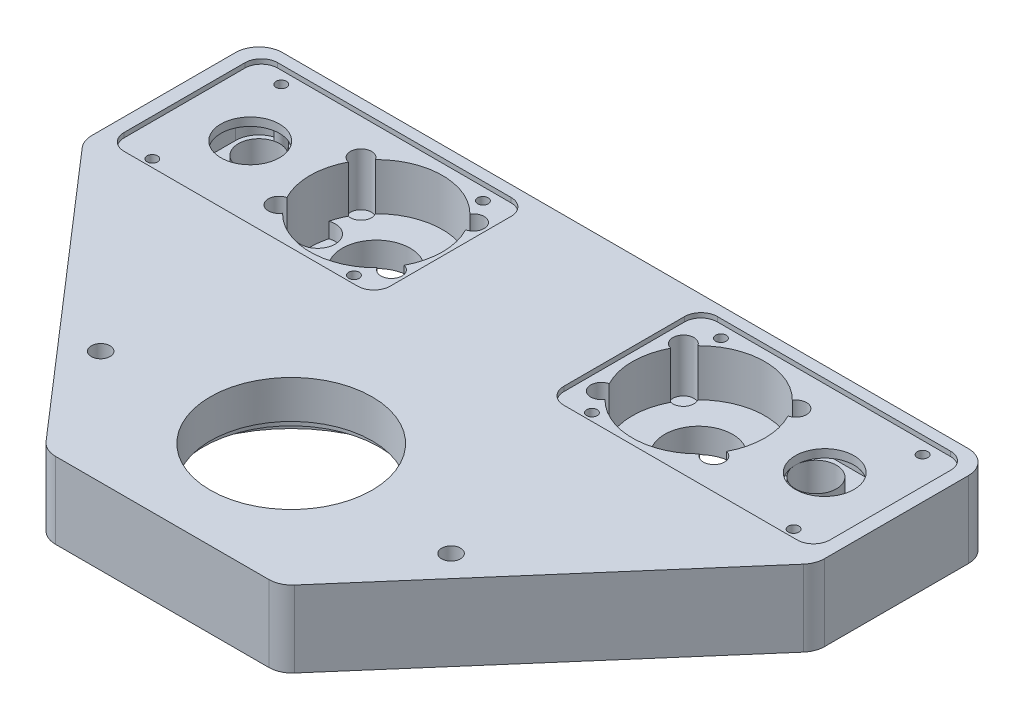
from build123d import *

# Parameters (mm, degrees)
SKETCH1_R             = 2.032
SKETCH1_R_2           = 7.366
SKETCH1_R_3           = 11.176
SKETCH1_R_4           = 17.526
BOSS_EXTRUDE1_DEPTH   = 16.51
CUT_EXTRUDE4_DEPTH    = 6.35
SKETCH2_R             = 19.05
SKETCH2_R_2           = 12.7
CUT_EXTRUDE3_DEPTH    = 1.905
CAVITY1_START         = 5.334
CAVITY1_OUTLINE_R     = 7.366
CAVITY1_OUTLINE_R_2   = 1.143
CAVITY1_OUTLINE_R_3   = 4.445
CAVITY1_DEPTH         = 11.176
CAVITY1_START_2       = 15.494
CAVITY1_2_OUTLINE_R   = 1.143
CAVITY1_2_OUTLINE_R_2 = 4.445
CAVITY1_2_DEPTH       = 1.016
CAVITY1_START_3       = 2.286
CAVITY1_3_OUTLINE_R   = 1.143
CAVITY1_3_OUTLINE_R_2 = 4.445
CAVITY1_3_DEPTH       = 3.048
CAVITY1_4_OUTLINE_R   = 1.905
CAVITY1_4_DEPTH       = 3.302
CAVITY1_START_4       = 13.716
CAVITY1_5_DEPTH       = 1.778
CAVITY1_START_5       = 4.064
CAVITY1_6_OUTLINE_R   = 2.286
CAVITY1_6_DEPTH       = 1.27
CAVITY1_START_6       = 2.032
CAVITY1_7_DEPTH       = 0.254
BOSS_EXTRUDE2_START   = -1.27
SKETCH4_R             = 11.176
BOSS_EXTRUDE2_DEPTH   = 1.27
FILLET1_R             = 5.08
SKETCH5_W             = 6.604
SKETCH5_H             = 6.604
CUT_EXTRUDE5_DEPTH    = 6.35


# Read off the part's stored shape, not the designer's step: Cavity1
with BuildPart() as part:
    # Sketch1 → Boss-Extrude1 (new body)
    with BuildSketch(Plane(origin=(0, 0, 0), x_dir=(1, 0, 0), z_dir=(0, 1, 0))):
        Polygon((25.4, -66.04), (-25.4, -66.04), (-79.375, -3.81), (-79.375, 34.29), (79.375, 34.29), (79.375, -3.81), align=None)
        with Locations(Location((-37.955017997, -41.420633799, 0), (0, 0, 270))):
            Circle(SKETCH1_R, mode=Mode.SUBTRACT)
        with Locations(Location((-34.919226796, 15.24, 0), (0, 0, 270))):
            Circle(SKETCH1_R_2, mode=Mode.SUBTRACT)
        with Locations(Location((0, 0, 0), (0, 0, 270))):
            Circle(SKETCH1_R_3, mode=Mode.SUBTRACT)
        with Locations(Location((0, -38.1, 0), (0, 0, 270))):
            Circle(SKETCH1_R_4, mode=Mode.SUBTRACT)
        with Locations(Location((37.955017997, -41.420633799, 0), (0, 0, 90))):
            Circle(SKETCH1_R, mode=Mode.SUBTRACT)
        with Locations(Location((34.919226796, 15.24, 0), (0, 0, 90))):
            Circle(SKETCH1_R_2, mode=Mode.SUBTRACT)
    extrude(amount=BOSS_EXTRUDE1_DEPTH)

    # Sketch3 → Cut-Extrude4 (cut)
    with BuildSketch(Plane.XZ):
        with BuildLine():
            ThreePointArc((9.692022286, 12.573), (0, 65.405), (-9.692022286, 12.573))
            ThreePointArc((-9.692022286, 12.573), (0, -15.875), (9.692022286, 12.573))
        make_face()
    extrude(amount=-CUT_EXTRUDE4_DEPTH, mode=Mode.SUBTRACT)

    # Sketch2 → Cut-Extrude3 (cut)
    with BuildSketch(Plane(origin=(0, 6.35, 0), x_dir=(-1, 0, 0), z_dir=(0, -1, 0))):
        with Locations(Location((0, -38.1, 0), (0, 0, 90))):
            Circle(SKETCH2_R)
        with Locations(Location((0, 0, 0), (0, 0, 90))):
            Circle(SKETCH2_R_2)
    extrude(amount=-CUT_EXTRUDE3_DEPTH, mode=Mode.SUBTRACT)

    # Cavity1 outline → Cavity1 (cut)
    # profile 1 of 12: a face of its own
    with BuildSketch(Plane(origin=(0, 0, 0), x_dir=(1, 0, 0), z_dir=(0, 1, 0)).offset(CAVITY1_START)):
        with BuildLine():
            ThreePointArc((24.688659292, 5.175871148), (34.919226795, 0.889), (45.149794299, 5.175871148))
            ThreePointArc((45.149794299, 5.175871148), (48.95833201, 5.003152448), (47.629415314, 8.576494253))
            ThreePointArc((47.629415314, 8.576494253), (49.270226796, 15.24), (47.629415314, 21.903505747))
            ThreePointArc((47.629415314, 21.903505747), (48.95833201, 25.476847552), (45.149794299, 25.304128852))
            ThreePointArc((45.149794299, 25.304128852), (34.919226796, 29.591), (24.688659292, 25.304128852))
            ThreePointArc((24.688659292, 25.304128852), (20.880121582, 25.476847552), (22.209038278, 21.903505747))
            ThreePointArc((22.209038278, 21.903505747), (20.568226796, 15.24), (22.209038278, 8.576494253))
            ThreePointArc((22.209038278, 8.576494253), (20.880121582, 5.003152448), (24.688659292, 5.175871148))
        make_face()
        with Locations((34.919226796, 15.24)):
            Circle(CAVITY1_OUTLINE_R, mode=Mode.SUBTRACT)
    # profile 2 of 12: a face of its own
    with BuildSketch(Plane(origin=(0, 0, 0), x_dir=(1, 0, 0), z_dir=(0, 1, 0)).offset(CAVITY1_START)):
        with Locations((25.775226796, 1.27)):
            Circle(CAVITY1_OUTLINE_R_2)
    # profile 3 of 12: a face of its own
    with BuildSketch(Plane(origin=(0, 0, 0), x_dir=(1, 0, 0), z_dir=(0, 1, 0)).offset(CAVITY1_START)):
        with Locations((69.463226796, 1.27)):
            Circle(CAVITY1_OUTLINE_R_2)
    # profile 4 of 12: a face of its own
    with BuildSketch(Plane(origin=(0, 0, 0), x_dir=(1, 0, 0), z_dir=(0, 1, 0)).offset(CAVITY1_START)):
        with Locations((25.775226796, 29.21)):
            Circle(CAVITY1_OUTLINE_R_2)
    # profile 5 of 12: a face of its own
    with BuildSketch(Plane(origin=(0, 0, 0), x_dir=(1, 0, 0), z_dir=(0, 1, 0)).offset(CAVITY1_START)):
        with BuildLine():
            ThreePointArc((-24.688659292, 25.304128852), (-34.919226796, 29.591), (-45.149794299, 25.304128852))
            ThreePointArc((-45.149794299, 25.304128852), (-48.95833201, 25.476847552), (-47.629415314, 21.903505747))
            ThreePointArc((-47.629415314, 21.903505747), (-49.270226796, 15.24), (-47.629415314, 8.576494253))
            ThreePointArc((-47.629415314, 8.576494253), (-48.95833201, 5.003152448), (-45.149794299, 5.175871148))
            ThreePointArc((-45.149794299, 5.175871148), (-34.919226796, 0.889), (-24.688659292, 5.175871148))
            ThreePointArc((-24.688659292, 5.175871148), (-20.880121582, 5.003152448), (-22.209038278, 8.576494253))
            ThreePointArc((-22.209038278, 8.576494253), (-20.568226796, 15.24), (-22.209038278, 21.903505747))
            ThreePointArc((-22.209038278, 21.903505747), (-20.880121582, 25.476847552), (-24.688659292, 25.304128852))
        make_face()
        with Locations((-34.919226796, 15.24)):
            Circle(CAVITY1_OUTLINE_R, mode=Mode.SUBTRACT)
    # profile 6 of 12: a face of its own
    with BuildSketch(Plane(origin=(0, 0, 0), x_dir=(1, 0, 0), z_dir=(0, 1, 0)).offset(CAVITY1_START)):
        with Locations((60.319226796, 15.24)):
            Circle(CAVITY1_OUTLINE_R_3)
    # profile 7 of 12: a face of its own
    with BuildSketch(Plane(origin=(0, 0, 0), x_dir=(1, 0, 0), z_dir=(0, 1, 0)).offset(CAVITY1_START)):
        with Locations((-25.775226796, 1.27)):
            Circle(CAVITY1_OUTLINE_R_2)
    # profile 8 of 12: a face of its own
    with BuildSketch(Plane(origin=(0, 0, 0), x_dir=(1, 0, 0), z_dir=(0, 1, 0)).offset(CAVITY1_START)):
        with Locations((-25.775226796, 29.21)):
            Circle(CAVITY1_OUTLINE_R_2)
    # profile 9 of 12: a face of its own
    with BuildSketch(Plane(origin=(0, 0, 0), x_dir=(1, 0, 0), z_dir=(0, 1, 0)).offset(CAVITY1_START)):
        with Locations((69.463226796, 29.21)):
            Circle(CAVITY1_OUTLINE_R_2)
    # profile 10 of 12: a face of its own
    with BuildSketch(Plane(origin=(0, 0, 0), x_dir=(1, 0, 0), z_dir=(0, 1, 0)).offset(CAVITY1_START)):
        with Locations((-69.463226796, 1.27)):
            Circle(CAVITY1_OUTLINE_R_2)
    # profile 11 of 12: a face of its own
    with BuildSketch(Plane(origin=(0, 0, 0), x_dir=(1, 0, 0), z_dir=(0, 1, 0)).offset(CAVITY1_START)):
        with Locations((-69.463226796, 29.21)):
            Circle(CAVITY1_OUTLINE_R_2)
    # profile 12 of 12: a face of its own
    with BuildSketch(Plane(origin=(0, 0, 0), x_dir=(1, 0, 0), z_dir=(0, 1, 0)).offset(CAVITY1_START)):
        with Locations((-60.319226796, 15.24)):
            Circle(CAVITY1_OUTLINE_R_3)
    extrude(amount=CAVITY1_DEPTH, mode=Mode.SUBTRACT)

    # Cavity1 2 outline → Cavity1 2 (cut)
    # profile 1 of 2: a face of its own
    with BuildSketch(Plane(origin=(0, 0, 0), x_dir=(1, 0, 0), z_dir=(0, 1, 0)).offset(CAVITY1_START_2)):
        with BuildLine():
            ThreePointArc((18.790226796, 2.159), (19.831755082, -0.355471714), (22.346226796, -1.397))
            Line((22.346226796, -1.397), (72.892226796, -1.397))
            ThreePointArc((72.892226796, -1.397), (75.40669851, -0.355471713), (76.448226796, 2.159))
            Line((76.448226796, 2.159), (76.448226796, 28.321))
            ThreePointArc((76.448226796, 28.321), (75.40669851, 30.835471713), (72.892226796, 31.877))
            Line((72.892226796, 31.877), (22.346226796, 31.877))
            ThreePointArc((22.346226796, 31.877), (19.831755082, 30.835471714), (18.790226796, 28.321))
            Line((18.790226796, 28.321), (18.790226796, 2.159))
        make_face()
        with BuildLine():
            ThreePointArc((22.209038278, 8.576494253), (20.568226796, 15.24), (22.209038278, 21.903505747))
            ThreePointArc((22.209038278, 21.903505747), (20.880121582, 25.476847552), (24.688659292, 25.304128852))
            ThreePointArc((24.688659292, 25.304128852), (34.919226796, 29.591), (45.149794299, 25.304128852))
            ThreePointArc((45.149794299, 25.304128852), (48.95833201, 25.476847552), (47.629415314, 21.903505747))
            ThreePointArc((47.629415314, 21.903505747), (49.270226796, 15.24), (47.629415314, 8.576494253))
            ThreePointArc((47.629415314, 8.576494253), (48.95833201, 5.003152448), (45.149794299, 5.175871148))
            ThreePointArc((45.149794299, 5.175871148), (34.919226795, 0.889), (24.688659292, 5.175871148))
            ThreePointArc((24.688659292, 5.175871148), (20.880121582, 5.003152448), (22.209038278, 8.576494253))
        make_face(mode=Mode.SUBTRACT)
        with Locations((25.775226796, 1.27)):
            Circle(CAVITY1_2_OUTLINE_R, mode=Mode.SUBTRACT)
        with Locations((25.775226796, 29.21)):
            Circle(CAVITY1_2_OUTLINE_R, mode=Mode.SUBTRACT)
        with Locations((60.319226796, 15.24)):
            Circle(CAVITY1_2_OUTLINE_R_2, mode=Mode.SUBTRACT)
        with Locations((69.463226796, 1.27)):
            Circle(CAVITY1_2_OUTLINE_R, mode=Mode.SUBTRACT)
        with Locations((69.463226796, 29.21)):
            Circle(CAVITY1_2_OUTLINE_R, mode=Mode.SUBTRACT)
    # profile 2 of 2: a face of its own
    with BuildSketch(Plane(origin=(0, 0, 0), x_dir=(1, 0, 0), z_dir=(0, 1, 0)).offset(CAVITY1_START_2)):
        with BuildLine():
            Line((-22.346226796, 31.877), (-72.892226796, 31.877))
            ThreePointArc((-72.892226796, 31.877), (-75.40669851, 30.835471713), (-76.448226796, 28.321))
            Line((-76.448226796, 28.321), (-76.448226796, 2.159))
            ThreePointArc((-76.448226796, 2.159), (-75.40669851, -0.355471713), (-72.892226796, -1.397))
            Line((-72.892226796, -1.397), (-22.346226796, -1.397))
            ThreePointArc((-22.346226796, -1.397), (-19.831755082, -0.355471714), (-18.790226796, 2.159))
            Line((-18.790226796, 2.159), (-18.790226796, 28.321))
            ThreePointArc((-18.790226796, 28.321), (-19.831755082, 30.835471714), (-22.346226796, 31.877))
        make_face()
        with BuildLine():
            ThreePointArc((-22.209038278, 21.903505747), (-20.568226796, 15.24), (-22.209038278, 8.576494253))
            ThreePointArc((-22.209038278, 8.576494253), (-20.880121582, 5.003152448), (-24.688659292, 5.175871148))
            ThreePointArc((-24.688659292, 5.175871148), (-34.919226796, 0.889), (-45.149794299, 5.175871148))
            ThreePointArc((-45.149794299, 5.175871148), (-48.95833201, 5.003152448), (-47.629415314, 8.576494253))
            ThreePointArc((-47.629415314, 8.576494253), (-49.270226796, 15.24), (-47.629415314, 21.903505747))
            ThreePointArc((-47.629415314, 21.903505747), (-48.95833201, 25.476847552), (-45.149794299, 25.304128852))
            ThreePointArc((-45.149794299, 25.304128852), (-34.919226796, 29.591), (-24.688659292, 25.304128852))
            ThreePointArc((-24.688659292, 25.304128852), (-20.880121582, 25.476847552), (-22.209038278, 21.903505747))
        make_face(mode=Mode.SUBTRACT)
        with Locations((-25.775226796, 29.21)):
            Circle(CAVITY1_2_OUTLINE_R, mode=Mode.SUBTRACT)
        with Locations((-25.775226796, 1.27)):
            Circle(CAVITY1_2_OUTLINE_R, mode=Mode.SUBTRACT)
        with Locations((-60.319226796, 15.24)):
            Circle(CAVITY1_2_OUTLINE_R_2, mode=Mode.SUBTRACT)
        with Locations((-69.463226796, 29.21)):
            Circle(CAVITY1_2_OUTLINE_R, mode=Mode.SUBTRACT)
        with Locations((-69.463226796, 1.27)):
            Circle(CAVITY1_2_OUTLINE_R, mode=Mode.SUBTRACT)
    extrude(amount=CAVITY1_2_DEPTH, mode=Mode.SUBTRACT)

    # Cavity1 3 outline → Cavity1 3 (cut)
    with BuildSketch(Plane(origin=(0, 0, 0), x_dir=(1, 0, 0), z_dir=(0, 1, 0)).offset(CAVITY1_START_3)):
        with Locations((25.775226796, 1.27)):
            Circle(CAVITY1_3_OUTLINE_R)
        with Locations((69.463226796, 1.27)):
            Circle(CAVITY1_3_OUTLINE_R)
        with BuildLine():
            ThreePointArc((48.806041796, 18.86043784), (43.809226796, 15.24), (48.806041796, 11.61956216))
            ThreePointArc((48.806041796, 11.61956216), (49.270226796, 15.24), (48.806041796, 18.86043784))
        make_face()
        with Locations((25.775226796, 29.21)):
            Circle(CAVITY1_3_OUTLINE_R)
        with Locations((60.319226796, 15.24)):
            Circle(CAVITY1_3_OUTLINE_R_2)
        with Locations((-25.775226796, 1.27)):
            Circle(CAVITY1_3_OUTLINE_R)
        with Locations((-25.775226796, 29.21)):
            Circle(CAVITY1_3_OUTLINE_R)
        with Locations((69.463226796, 29.21)):
            Circle(CAVITY1_3_OUTLINE_R)
        with Locations((-69.463226796, 1.27)):
            Circle(CAVITY1_3_OUTLINE_R)
        with Locations((-69.463226796, 29.21)):
            Circle(CAVITY1_3_OUTLINE_R)
        with BuildLine():
            ThreePointArc((-48.806041796, 18.86043784), (-49.270226796, 15.24), (-48.806041796, 11.61956216))
            ThreePointArc((-48.806041796, 11.61956216), (-43.809226796, 15.24), (-48.806041796, 18.86043784))
        make_face()
        with Locations((-60.319226796, 15.24)):
            Circle(CAVITY1_3_OUTLINE_R_2)
    extrude(amount=CAVITY1_3_DEPTH, mode=Mode.SUBTRACT)

    # Cavity1 4 outline → Cavity1 4 (cut)
    with BuildSketch(Plane(origin=(0, 0, 0), x_dir=(1, 0, 0), z_dir=(0, 1, 0))):
        with Locations((25.775226796, 1.27)):
            Circle(CAVITY1_4_OUTLINE_R)
        with Locations((69.463226796, 1.27)):
            Circle(CAVITY1_4_OUTLINE_R)
        with Locations((25.775226796, 29.21)):
            Circle(CAVITY1_4_OUTLINE_R)
        with Locations((-25.775226796, 1.27)):
            Circle(CAVITY1_4_OUTLINE_R)
        with Locations((-25.775226796, 29.21)):
            Circle(CAVITY1_4_OUTLINE_R)
        with Locations((69.463226796, 29.21)):
            Circle(CAVITY1_4_OUTLINE_R)
        with Locations((-69.463226796, 1.27)):
            Circle(CAVITY1_4_OUTLINE_R)
        with Locations((-69.463226796, 29.21)):
            Circle(CAVITY1_4_OUTLINE_R)
    extrude(amount=CAVITY1_4_DEPTH, mode=Mode.SUBTRACT)

    # Cavity1 5 outline → Cavity1 5 (cut)
    with BuildSketch(Plane(origin=(0, 0, 0), x_dir=(1, 0, 0), z_dir=(0, 1, 0)).offset(CAVITY1_START_4)):
        with BuildLine():
            Line((59.308285461, 10.911487251), (61.21795276, 8.970238237))
            ThreePointArc((61.21795276, 8.970238237), (65.207576572, 9.634455948), (67.986896437, 12.572765737))
            Line((67.986896437, 12.572765737), (64.495295738, 13.71734666))
            ThreePointArc((64.495295738, 13.71734666), (62.434107395, 11.330357427), (59.308285461, 10.911487251))
        make_face()
        with BuildLine():
            ThreePointArc((56.000875132, 13.978099029), (57.826893585, 10.658956382), (61.21795276, 8.970238237))
            Line((61.21795276, 8.970238237), (59.308285461, 10.911487251))
            ThreePointArc((59.308285461, 10.911487251), (57.262889291, 12.012489186), (56.052168703, 13.994913564))
            Line((56.052168703, 13.994913564), (56.000875132, 13.978099029))
        make_face()
        with BuildLine():
            Line((64.495295738, 13.71734666), (67.986896437, 12.572765737))
            ThreePointArc((67.986896437, 12.572765737), (68.425656156, 13.874432759), (68.574226796, 15.24))
            ThreePointArc((68.574226796, 15.24), (68.425656156, 16.605567241), (67.986896437, 17.907234263))
            Line((67.986896437, 17.907234263), (64.495295738, 16.76265334))
            ThreePointArc((64.495295738, 16.76265334), (64.696477728, 16.013110132), (64.764226796, 15.24))
            ThreePointArc((64.764226796, 15.24), (64.696477728, 14.466889868), (64.495295738, 13.71734666))
        make_face()
        with BuildLine():
            ThreePointArc((55.938804378, 14.336692172), (55.967270306, 14.156950841), (56.000875132, 13.978099029))
            Line((56.000875132, 13.978099029), (56.052168703, 13.994913564))
            ThreePointArc((56.052168703, 13.994913564), (56.010737642, 14.146864047), (55.974715733, 14.300186923))
            Line((55.974715733, 14.300186923), (55.938804378, 14.336692172))
        make_face()
        with BuildLine():
            Line((64.495295738, 16.76265334), (67.986896437, 17.907234263))
            ThreePointArc((67.986896437, 17.907234263), (65.207576572, 20.845544052), (61.21795276, 21.509761763))
            Line((61.21795276, 21.509761763), (59.308285461, 19.568512749))
            ThreePointArc((59.308285461, 19.568512749), (62.434107395, 19.149642573), (64.495295738, 16.76265334))
        make_face()
        with BuildLine():
            ThreePointArc((55.874226796, 15.24), (55.890391767, 14.787193392), (55.938804378, 14.336692172))
            Line((55.938804378, 14.336692172), (55.974715733, 14.300186923))
            ThreePointArc((55.974715733, 14.300186923), (55.899420427, 14.767414916), (55.874226796, 15.24))
        make_face()
        with BuildLine():
            Line((55.974715733, 16.179813077), (55.938804378, 16.143307828))
            ThreePointArc((55.938804378, 16.143307828), (55.890391767, 15.692806608), (55.874226796, 15.24))
            ThreePointArc((55.874226796, 15.24), (55.899420427, 15.712585084), (55.974715733, 16.179813077))
        make_face()
        with BuildLine():
            ThreePointArc((56.000875132, 16.501900971), (55.967270306, 16.323049159), (55.938804378, 16.143307828))
            Line((55.938804378, 16.143307828), (55.974715733, 16.179813077))
            ThreePointArc((55.974715733, 16.179813077), (56.010737642, 16.333135953), (56.052168703, 16.485086436))
            Line((56.052168703, 16.485086436), (56.000875132, 16.501900971))
        make_face()
        with BuildLine():
            Line((59.308285461, 19.568512749), (61.21795276, 21.509761763))
            ThreePointArc((61.21795276, 21.509761763), (57.826893585, 19.821043618), (56.000875132, 16.501900971))
            Line((56.000875132, 16.501900971), (56.052168703, 16.485086436))
            ThreePointArc((56.052168703, 16.485086436), (57.262889291, 18.467510814), (59.308285461, 19.568512749))
        make_face()
        with BuildLine():
            Line((-59.308285461, 10.911487251), (-61.21795276, 8.970238237))
            ThreePointArc((-61.21795276, 8.970238237), (-57.826893585, 10.658956382), (-56.000875132, 13.978099029))
            Line((-56.000875132, 13.978099029), (-56.052168703, 13.994913564))
            ThreePointArc((-56.052168703, 13.994913564), (-57.262889291, 12.012489186), (-59.308285461, 10.911487251))
        make_face()
        with BuildLine():
            ThreePointArc((-67.986896437, 12.572765737), (-65.207576572, 9.634455948), (-61.21795276, 8.970238237))
            Line((-61.21795276, 8.970238237), (-59.308285461, 10.911487251))
            ThreePointArc((-59.308285461, 10.911487251), (-62.434107395, 11.330357427), (-64.495295738, 13.71734666))
            Line((-64.495295738, 13.71734666), (-67.986896437, 12.572765737))
        make_face()
        with BuildLine():
            Line((-56.052168703, 13.994913564), (-56.000875132, 13.978099029))
            ThreePointArc((-56.000875132, 13.978099029), (-55.967270306, 14.156950841), (-55.938804378, 14.336692172))
            Line((-55.938804378, 14.336692172), (-55.974715733, 14.300186923))
            ThreePointArc((-55.974715733, 14.300186923), (-56.010737642, 14.146864047), (-56.052168703, 13.994913564))
        make_face()
        with BuildLine():
            ThreePointArc((-67.986896437, 17.907234263), (-68.574226796, 15.24), (-67.986896437, 12.572765737))
            Line((-67.986896437, 12.572765737), (-64.495295738, 13.71734666))
            ThreePointArc((-64.495295738, 13.71734666), (-64.764226796, 15.24), (-64.495295738, 16.76265334))
            Line((-64.495295738, 16.76265334), (-67.986896437, 17.907234263))
        make_face()
        with BuildLine():
            Line((-59.308285461, 19.568512749), (-61.21795276, 21.509761763))
            ThreePointArc((-61.21795276, 21.509761763), (-65.207576572, 20.845544052), (-67.986896437, 17.907234263))
            Line((-67.986896437, 17.907234263), (-64.495295738, 16.76265334))
            ThreePointArc((-64.495295738, 16.76265334), (-62.434107395, 19.149642573), (-59.308285461, 19.568512749))
        make_face()
        with BuildLine():
            ThreePointArc((-56.000875132, 16.501900971), (-57.826893585, 19.821043618), (-61.21795276, 21.509761763))
            Line((-61.21795276, 21.509761763), (-59.308285461, 19.568512749))
            ThreePointArc((-59.308285461, 19.568512749), (-57.262889291, 18.467510814), (-56.052168703, 16.485086436))
            Line((-56.052168703, 16.485086436), (-56.000875132, 16.501900971))
        make_face()
        with BuildLine():
            ThreePointArc((-55.938804378, 16.143307828), (-55.967270306, 16.323049159), (-56.000875132, 16.501900971))
            Line((-56.000875132, 16.501900971), (-56.052168703, 16.485086436))
            ThreePointArc((-56.052168703, 16.485086436), (-56.010737642, 16.333135953), (-55.974715733, 16.179813077))
            Line((-55.974715733, 16.179813077), (-55.938804378, 16.143307828))
        make_face()
        with BuildLine():
            Line((-55.974715733, 14.300186923), (-55.938804378, 14.336692172))
            ThreePointArc((-55.938804378, 14.336692172), (-55.890391767, 14.787193392), (-55.874226796, 15.24))
            ThreePointArc((-55.874226796, 15.24), (-55.899420427, 14.767414916), (-55.974715733, 14.300186923))
        make_face()
        with BuildLine():
            ThreePointArc((-55.874226796, 15.24), (-55.890391767, 15.692806608), (-55.938804378, 16.143307828))
            Line((-55.938804378, 16.143307828), (-55.974715733, 16.179813077))
            ThreePointArc((-55.974715733, 16.179813077), (-55.899420427, 15.712585084), (-55.874226796, 15.24))
        make_face()
    extrude(amount=CAVITY1_5_DEPTH, mode=Mode.SUBTRACT)

    # Cavity1 6 outline → Cavity1 6 (cut)
    with BuildSketch(Plane(origin=(0, 0, 0), x_dir=(1, 0, 0), z_dir=(0, 1, 0)).offset(CAVITY1_START_5)):
        with Locations((22.727226796, 6.35)):
            Circle(CAVITY1_6_OUTLINE_R)
        with Locations((47.111226796, 6.35)):
            Circle(CAVITY1_6_OUTLINE_R)
        with Locations((22.727226796, 24.13)):
            Circle(CAVITY1_6_OUTLINE_R)
        with Locations((47.111226796, 24.13)):
            Circle(CAVITY1_6_OUTLINE_R)
        with Locations((-22.727226796, 24.13)):
            Circle(CAVITY1_6_OUTLINE_R)
        with Locations((-22.727226796, 6.35)):
            Circle(CAVITY1_6_OUTLINE_R)
        with Locations((-47.111226796, 6.35)):
            Circle(CAVITY1_6_OUTLINE_R)
        with Locations((-47.111226796, 24.13)):
            Circle(CAVITY1_6_OUTLINE_R)
    extrude(amount=CAVITY1_6_DEPTH, mode=Mode.SUBTRACT)

    # Cavity1 7 outline → Cavity1 7 (cut)
    with BuildSketch(Plane(origin=(0, 0, 0), x_dir=(1, 0, 0), z_dir=(0, 1, 0)).offset(CAVITY1_START_6)):
        with BuildLine():
            ThreePointArc((48.806041796, 18.86043784), (43.809226796, 15.24), (48.806041796, 11.61956216))
            ThreePointArc((48.806041796, 11.61956216), (49.270226796, 15.24), (48.806041796, 18.86043784))
        make_face()
        with BuildLine():
            ThreePointArc((-48.806041796, 18.86043784), (-49.270226796, 15.24), (-48.806041796, 11.61956216))
            ThreePointArc((-48.806041796, 11.61956216), (-43.809226796, 15.24), (-48.806041796, 18.86043784))
        make_face()
    extrude(amount=CAVITY1_7_DEPTH, mode=Mode.SUBTRACT)

    # Sketch4 → Boss-Extrude2 (add)
    with BuildSketch(Plane(origin=(0, 16.51, 0), x_dir=(1, 0, 0), z_dir=(0, 1, 0)).offset(BOSS_EXTRUDE2_START)):
        with Locations(Location((0, 0, 0), (0, 0, 90))):
            Circle(SKETCH4_R)
    extrude(amount=BOSS_EXTRUDE2_DEPTH)

    # Fillet1
    fillet1_edges = [part.edges().sort_by_distance(p)[0] for p in [
        (-79.375, 8.255, 3.81),
        (-79.375, 8.255, -34.29),
        (79.375, 8.255, -34.29),
        (79.375, 8.255, 3.81),
        (25.4, 8.255, 66.04),
        (-25.4, 8.255, 66.04),
    ]]
    fillet(fillet1_edges, radius=FILLET1_R)

    # Sketch5 → Cut-Extrude5 (cut)
    with BuildSketch(Plane.XZ):
        with Locations((37.955017997, 41.420633799)):
            Rectangle(SKETCH5_W, SKETCH5_H)
    cut_extrude5 = extrude(amount=-CUT_EXTRUDE5_DEPTH, mode=Mode.SUBTRACT)

    # Mirror1: Cut-Extrude5 across plane
    add(cut_extrude5.mirror(Plane(origin=(0, 0, 0), x_dir=(0, 0, 1), z_dir=(1, 0, 0))), mode=Mode.SUBTRACT)


solid = part.part
